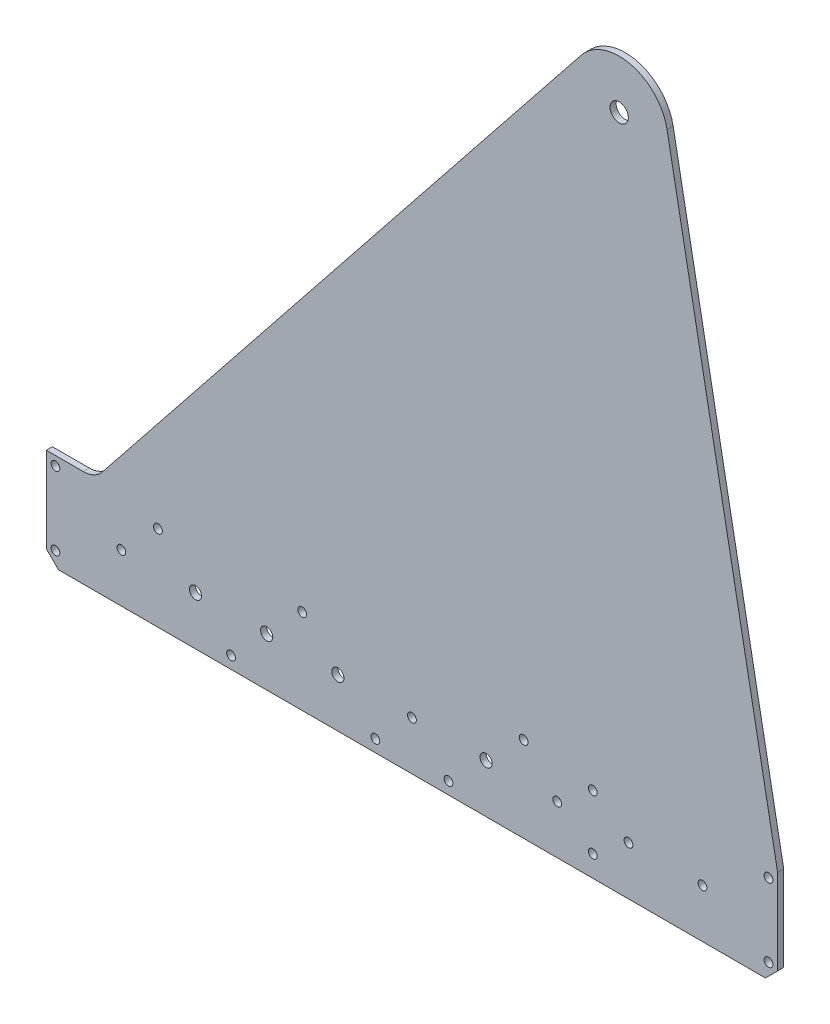
from build123d import *

# Parameters (mm, degrees)
BOSS_EXTRUDE1_DEPTH = 3.175
CUT_EXTRUDE1_REACH  = 538.584
SKETCH2_R           = 2.286
SKETCH2_R_2         = 3.175
SKETCH3_R           = 4.7625
CUT_EXTRUDE2_DEPTH  = 537.584393409


with BuildPart() as part:
    # Sketch1 → Boss-Extrude1 (new body)
    with BuildSketch(Plane.XY):
        with BuildLine():
            Line((0, 0), (381, 0))
            Line((381, 0), (381, 50.8))
            Line((381, 50.8), (323.412696837, 357.117948608))
            ThreePointArc((323.412696837, 357.117948608), (304.5790852, 377.074428282), (278.59222039, 368.26256891))
            Line((278.59222039, 368.26256891), (29.213257683, 55.581215545))
            ThreePointArc((29.213257683, 55.581215545), (24.794424022, 52.057566636), (19.284367878, 50.8))
            Line((19.284367878, 50.8), (0, 50.8))
            Line((0, 50.8), (0, 0))
        make_face()
    extrude(amount=BOSS_EXTRUDE1_DEPTH)

    # Sketch2 → Cut-Extrude1 (cut, up to next)
    with BuildSketch(Plane.XY.offset(3.175), mode=Mode.PRIVATE) as cut_extrude1_sk1:
        with Locations((39.116, 25.4)):
            Circle(SKETCH2_R)
    cut_extrude1_tool1 = extrude(cut_extrude1_sk1.sketch, amount=-CUT_EXTRUDE1_REACH, mode=Mode.PRIVATE) & part.part
    # Sketch2 → Cut-Extrude1 (cut, up to next)
    with BuildSketch(Plane.XY.offset(3.175), mode=Mode.PRIVATE) as cut_extrude1_sk2:
        with Locations((190.5, 25.4)):
            Circle(SKETCH2_R)
    cut_extrude1_tool2 = extrude(cut_extrude1_sk2.sketch, amount=-CUT_EXTRUDE1_REACH, mode=Mode.PRIVATE) & part.part
    # Sketch2 → Cut-Extrude1 (cut, up to next)
    with BuildSketch(Plane.XY.offset(3.175), mode=Mode.PRIVATE) as cut_extrude1_sk3:
        with Locations((114.808, 25.4)):
            Circle(SKETCH2_R_2)
    cut_extrude1_tool3 = extrude(cut_extrude1_sk3.sketch, amount=-CUT_EXTRUDE1_REACH, mode=Mode.PRIVATE) & part.part
    # Sketch2 → Cut-Extrude1 (cut, up to next)
    with BuildSketch(Plane.XY.offset(3.175), mode=Mode.PRIVATE) as cut_extrude1_sk4:
        with Locations((77.724, 25.4)):
            Circle(SKETCH2_R_2)
    cut_extrude1_tool4 = extrude(cut_extrude1_sk4.sketch, amount=-CUT_EXTRUDE1_REACH, mode=Mode.PRIVATE) & part.part
    # Sketch2 → Cut-Extrude1 (cut, up to next)
    with BuildSketch(Plane.XY.offset(3.175), mode=Mode.PRIVATE) as cut_extrude1_sk5:
        with Locations((151.892, 25.4)):
            Circle(SKETCH2_R_2)
    cut_extrude1_tool5 = extrude(cut_extrude1_sk5.sketch, amount=-CUT_EXTRUDE1_REACH, mode=Mode.PRIVATE) & part.part
    # Sketch2 → Cut-Extrude1 (cut, up to next)
    with BuildSketch(Plane.XY.offset(3.175), mode=Mode.PRIVATE) as cut_extrude1_sk6:
        with Locations((229.108, 25.4)):
            Circle(SKETCH2_R_2)
    cut_extrude1_tool6 = extrude(cut_extrude1_sk6.sketch, amount=-CUT_EXTRUDE1_REACH, mode=Mode.PRIVATE) & part.part
    # Sketch2 → Cut-Extrude1 (cut, up to next)
    with BuildSketch(Plane.XY.offset(3.175), mode=Mode.PRIVATE) as cut_extrude1_sk7:
        with Locations((303.276, 25.4)):
            Circle(SKETCH2_R)
    cut_extrude1_tool7 = extrude(cut_extrude1_sk7.sketch, amount=-CUT_EXTRUDE1_REACH, mode=Mode.PRIVATE) & part.part
    # Sketch2 → Cut-Extrude1 (cut, up to next)
    with BuildSketch(Plane.XY.offset(3.175), mode=Mode.PRIVATE) as cut_extrude1_sk8:
        with Locations((266.192, 25.4)):
            Circle(SKETCH2_R)
    cut_extrude1_tool8 = extrude(cut_extrude1_sk8.sketch, amount=-CUT_EXTRUDE1_REACH, mode=Mode.PRIVATE) & part.part
    # Sketch2 → Cut-Extrude1 (cut, up to next)
    with BuildSketch(Plane.XY.offset(3.175), mode=Mode.PRIVATE) as cut_extrude1_sk9:
        with Locations((341.884, 25.4)):
            Circle(SKETCH2_R)
    cut_extrude1_tool9 = extrude(cut_extrude1_sk9.sketch, amount=-CUT_EXTRUDE1_REACH, mode=Mode.PRIVATE) & part.part
    # Sketch2 → Cut-Extrude1 (cut, up to next)
    with BuildSketch(Plane.XY.offset(3.175), mode=Mode.PRIVATE) as cut_extrude1_sk10:
        with Locations((58.166, 44.45)):
            Circle(SKETCH2_R)
    cut_extrude1_tool10 = extrude(cut_extrude1_sk10.sketch, amount=-CUT_EXTRUDE1_REACH, mode=Mode.PRIVATE) & part.part
    # Sketch2 → Cut-Extrude1 (cut, up to next)
    with BuildSketch(Plane.XY.offset(3.175), mode=Mode.PRIVATE) as cut_extrude1_sk11:
        with Locations((171.45, 6.35)):
            Circle(SKETCH2_R)
    cut_extrude1_tool11 = extrude(cut_extrude1_sk11.sketch, amount=-CUT_EXTRUDE1_REACH, mode=Mode.PRIVATE) & part.part
    # Sketch2 → Cut-Extrude1 (cut, up to next)
    with BuildSketch(Plane.XY.offset(3.175), mode=Mode.PRIVATE) as cut_extrude1_sk12:
        with Locations((209.55, 6.35)):
            Circle(SKETCH2_R)
    cut_extrude1_tool12 = extrude(cut_extrude1_sk12.sketch, amount=-CUT_EXTRUDE1_REACH, mode=Mode.PRIVATE) & part.part
    # Sketch2 → Cut-Extrude1 (cut, up to next)
    with BuildSketch(Plane.XY.offset(3.175), mode=Mode.PRIVATE) as cut_extrude1_sk13:
        with Locations((133.35, 44.45)):
            Circle(SKETCH2_R)
    cut_extrude1_tool13 = extrude(cut_extrude1_sk13.sketch, amount=-CUT_EXTRUDE1_REACH, mode=Mode.PRIVATE) & part.part
    # Sketch2 → Cut-Extrude1 (cut, up to next)
    with BuildSketch(Plane.XY.offset(3.175), mode=Mode.PRIVATE) as cut_extrude1_sk14:
        with Locations((248.666, 44.45)):
            Circle(SKETCH2_R)
    cut_extrude1_tool14 = extrude(cut_extrude1_sk14.sketch, amount=-CUT_EXTRUDE1_REACH, mode=Mode.PRIVATE) & part.part
    # Sketch2 → Cut-Extrude1 (cut, up to next)
    with BuildSketch(Plane.XY.offset(3.175), mode=Mode.PRIVATE) as cut_extrude1_sk15:
        with Locations((96.266, 6.35)):
            Circle(SKETCH2_R)
    cut_extrude1_tool15 = extrude(cut_extrude1_sk15.sketch, amount=-CUT_EXTRUDE1_REACH, mode=Mode.PRIVATE) & part.part
    # Sketch2 → Cut-Extrude1 (cut, up to next)
    with BuildSketch(Plane.XY.offset(3.175), mode=Mode.PRIVATE) as cut_extrude1_sk16:
        with Locations((4.7625, 46.0375)):
            Circle(SKETCH2_R)
    cut_extrude1_tool16 = extrude(cut_extrude1_sk16.sketch, amount=-CUT_EXTRUDE1_REACH, mode=Mode.PRIVATE) & part.part
    # Sketch2 → Cut-Extrude1 (cut, up to next)
    with BuildSketch(Plane.XY.offset(3.175), mode=Mode.PRIVATE) as cut_extrude1_sk17:
        with Locations((4.7625, 7.9375)):
            Circle(SKETCH2_R)
    cut_extrude1_tool17 = extrude(cut_extrude1_sk17.sketch, amount=-CUT_EXTRUDE1_REACH, mode=Mode.PRIVATE) & part.part
    # Sketch2 → Cut-Extrude1 (cut, up to next)
    with BuildSketch(Plane.XY.offset(3.175), mode=Mode.PRIVATE) as cut_extrude1_sk18:
        with Locations((376.2375, 7.9375)):
            Circle(SKETCH2_R)
    cut_extrude1_tool18 = extrude(cut_extrude1_sk18.sketch, amount=-CUT_EXTRUDE1_REACH, mode=Mode.PRIVATE) & part.part
    # Sketch2 → Cut-Extrude1 (cut, up to next)
    with BuildSketch(Plane.XY.offset(3.175), mode=Mode.PRIVATE) as cut_extrude1_sk19:
        with Locations((376.2375, 46.0375)):
            Circle(SKETCH2_R)
    cut_extrude1_tool19 = extrude(cut_extrude1_sk19.sketch, amount=-CUT_EXTRUDE1_REACH, mode=Mode.PRIVATE) & part.part
    # Sketch2 → Cut-Extrude1 (cut, up to next)
    with BuildSketch(Plane.XY.offset(3.175), mode=Mode.PRIVATE) as cut_extrude1_sk20:
        with Locations((284.734, 11.1125)):
            Circle(SKETCH2_R)
    cut_extrude1_tool20 = extrude(cut_extrude1_sk20.sketch, amount=-CUT_EXTRUDE1_REACH, mode=Mode.PRIVATE) & part.part
    # Sketch2 → Cut-Extrude1 (cut, up to next)
    with BuildSketch(Plane.XY.offset(3.175), mode=Mode.PRIVATE) as cut_extrude1_sk21:
        with Locations((284.734, 39.6875)):
            Circle(SKETCH2_R)
    cut_extrude1_tool21 = extrude(cut_extrude1_sk21.sketch, amount=-CUT_EXTRUDE1_REACH, mode=Mode.PRIVATE) & part.part
    # Sketch2 → Cut-Extrude1 (cut, up to next)
    with BuildSketch(Plane.XY.offset(3.175), mode=Mode.PRIVATE) as cut_extrude1_sk22:
        Polygon((0, 6.35), (0, 0), (6.35, 0), align=None)
    cut_extrude1_tool22 = extrude(cut_extrude1_sk22.sketch, amount=-CUT_EXTRUDE1_REACH, mode=Mode.PRIVATE) & part.part
    # Sketch2 → Cut-Extrude1 (cut, up to next)
    with BuildSketch(Plane.XY.offset(3.175), mode=Mode.PRIVATE) as cut_extrude1_sk23:
        Polygon((381, 0), (374.65, 0), (381, 6.35), align=None)
    cut_extrude1_tool23 = extrude(cut_extrude1_sk23.sketch, amount=-CUT_EXTRUDE1_REACH, mode=Mode.PRIVATE) & part.part
    add(cut_extrude1_tool1.solids().sort_by_distance((39.116, 25.4, 3.175))[0], mode=Mode.SUBTRACT)
    add(cut_extrude1_tool2.solids().sort_by_distance((190.5, 25.4, 3.175))[0], mode=Mode.SUBTRACT)
    add(cut_extrude1_tool3.solids().sort_by_distance((114.808, 25.4, 3.175))[0], mode=Mode.SUBTRACT)
    add(cut_extrude1_tool4.solids().sort_by_distance((77.724, 25.4, 3.175))[0], mode=Mode.SUBTRACT)
    add(cut_extrude1_tool5.solids().sort_by_distance((151.892, 25.4, 3.175))[0], mode=Mode.SUBTRACT)
    add(cut_extrude1_tool6.solids().sort_by_distance((229.108, 25.4, 3.175))[0], mode=Mode.SUBTRACT)
    add(cut_extrude1_tool7.solids().sort_by_distance((303.276, 25.4, 3.175))[0], mode=Mode.SUBTRACT)
    add(cut_extrude1_tool8.solids().sort_by_distance((266.192, 25.4, 3.175))[0], mode=Mode.SUBTRACT)
    add(cut_extrude1_tool9.solids().sort_by_distance((341.884, 25.4, 3.175))[0], mode=Mode.SUBTRACT)
    add(cut_extrude1_tool10.solids().sort_by_distance((58.166, 44.45, 3.175))[0], mode=Mode.SUBTRACT)
    add(cut_extrude1_tool11.solids().sort_by_distance((171.45, 6.35, 3.175))[0], mode=Mode.SUBTRACT)
    add(cut_extrude1_tool12.solids().sort_by_distance((209.55, 6.35, 3.175))[0], mode=Mode.SUBTRACT)
    add(cut_extrude1_tool13.solids().sort_by_distance((133.35, 44.45, 3.175))[0], mode=Mode.SUBTRACT)
    add(cut_extrude1_tool14.solids().sort_by_distance((248.666, 44.45, 3.175))[0], mode=Mode.SUBTRACT)
    add(cut_extrude1_tool15.solids().sort_by_distance((96.266, 6.35, 3.175))[0], mode=Mode.SUBTRACT)
    add(cut_extrude1_tool16.solids().sort_by_distance((4.7625, 46.0375, 3.175))[0], mode=Mode.SUBTRACT)
    add(cut_extrude1_tool17.solids().sort_by_distance((4.7625, 7.9375, 3.175))[0], mode=Mode.SUBTRACT)
    add(cut_extrude1_tool18.solids().sort_by_distance((376.2375, 7.9375, 3.175))[0], mode=Mode.SUBTRACT)
    add(cut_extrude1_tool19.solids().sort_by_distance((376.2375, 46.0375, 3.175))[0], mode=Mode.SUBTRACT)
    add(cut_extrude1_tool20.solids().sort_by_distance((284.734, 11.1125, 3.175))[0], mode=Mode.SUBTRACT)
    add(cut_extrude1_tool21.solids().sort_by_distance((284.734, 39.6875, 3.175))[0], mode=Mode.SUBTRACT)
    add(cut_extrude1_tool22.solids().sort_by_distance((2.116667, 2.116667, 3.175))[0], mode=Mode.SUBTRACT)
    add(cut_extrude1_tool23.solids().sort_by_distance((378.883333, 2.116667, 3.175))[0], mode=Mode.SUBTRACT)

    # Sketch3 → Cut-Extrude2 (cut, through all)
    with BuildSketch(Plane.XY.offset(3.175)):
        with Locations((298.45, 352.425)):
            Circle(SKETCH3_R)
    extrude(amount=-CUT_EXTRUDE2_DEPTH, mode=Mode.SUBTRACT)


solid = part.part
